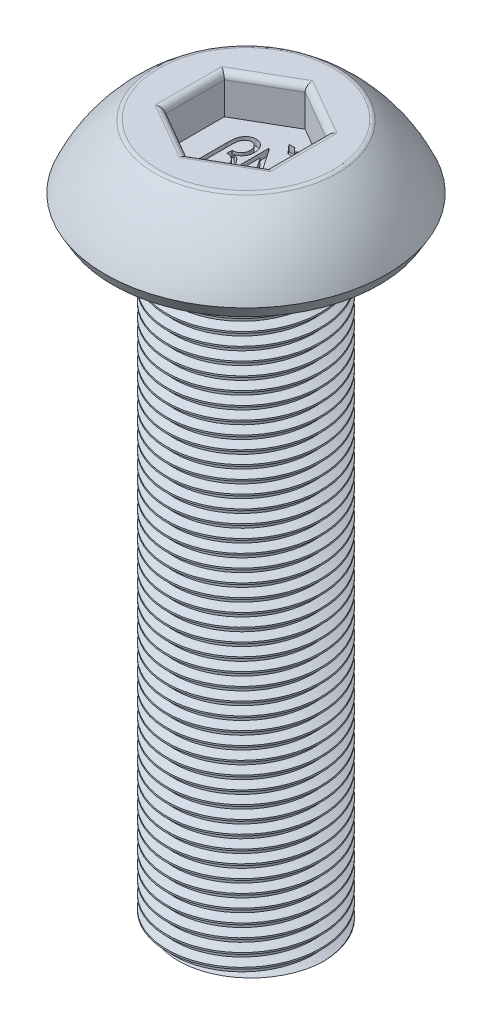
from build123d import *

# Parameters (mm, degrees)
CUT_EXTRUDE1_DEPTH = 0.75
FILLET1_R          = 0.125
WRAP1_START        = -0.125
WRAP1_DEPTH        = 0.125
THREAD1_PITCH      = 0.25


# Read off the part's stored shape, not the designer's step: Wrap1
with BuildPart() as part:
    # Sketch1 → Revolve1 (revolve)
    with BuildSketch(Plane(origin=(0, 0, 0), x_dir=(0, 0, -1), z_dir=(1, 0, 0)), mode=Mode.PRIVATE) as revolve1_sk:
        with BuildLine():
            Line((0, 1.5), (-1.75, 1.5))
            ThreePointArc((-1.75, 1.5), (-2.334912942, 0.942930354), (-2.75, 0.25))
            Line((-2.75, 0.25), (-2.605662433, 0))
            Line((-2.605662433, 0), (-1.5, 0))
            Line((-1.5, 0), (-1.5, -12))
            Line((-1.5, -12), (0, -12))
            Line((0, -12), (0, 1.5))
        make_face()
    revolve(revolve1_sk.sketch.rotate(Axis((0, -12, 0), (0, 1, 0)), 180), axis=Axis((0, -12, 0), (0, 1, 0)))

    # Sketch2 → Cut-Extrude1 (cut)
    with BuildSketch(Plane(origin=(0, 1.5, 0), x_dir=(1, 0, 0), z_dir=(0, 1, 0))):
        Polygon((0, 1.154700538), (-1, 0.577350269), (-1, -0.577350269), (0, -1.154700538), (1, -0.577350269), (1, 0.577350269), align=None)
    extrude(amount=-CUT_EXTRUDE1_DEPTH, mode=Mode.SUBTRACT)

    # Fillet1
    fillet1_edges = [part.edges().sort_by_distance(p)[0] for p in [
        (0.5, 1.5, -0.866025404),
        (-0.5, 1.5, -0.866025404),
        (-1, 1.5, 0),
        (-0.5, 1.5, 0.866025404),
        (0.5, 1.5, 0.866025404),
        (1, 1.5, 0),
        (0, 1.5, 1.75),
    ]]
    fillet(fillet1_edges, radius=FILLET1_R)

    # Wrap1 outline → Wrap1 (cut)
    with BuildSketch(Plane(origin=(0, 0.75, 0), x_dir=(1, 0, 0), z_dir=(0, 1, 0)).offset(WRAP1_START)):
        with BuildLine():
            add(Edge.make_bspline(
                [(-0.537455829, 0.145072229), (-0.537366548, 0.15735919), (-0.537194747, 0.181002472), (-0.536236546, 0.215136123), (-0.534510696, 0.246473554), (-0.531857696, 0.275057496), (-0.528751002, 0.300937263), (-0.524861231, 0.324098842), (-0.520025531, 0.344486675), (-0.512963856, 0.367808475), (-0.501673714, 0.39403328), (-0.484042302, 0.422215735), (-0.462961845, 0.447719467), (-0.43819726, 0.469796385), (-0.410438674, 0.48826361), (-0.379753396, 0.501330341), (-0.346770262, 0.509472114), (-0.323962243, 0.510388658), (-0.312295573, 0.510857485)],
                knots=[0, 0, 0, 0, 0.075666503, 0.145601872, 0.210267314, 0.268902852, 0.322354979, 0.370758742, 0.413447068, 0.451298193, 0.520734923, 0.588514213, 0.655379256, 0.723813985, 0.792131248, 0.85973193, 0.928250616, 1, 1, 1, 1], degree=3))
            Line((-0.537455829, 0.145072229), (-0.537455829, -0.527604053))
            Line((-0.537455829, -0.527604053), (-0.460532752, -0.527604053))
            Line((-0.460532752, -0.527604053), (-0.460532752, 0.137460049))
            add(Edge.make_bspline(
                [(-0.447712239, 0.305328639), (-0.448774545, 0.301469619), (-0.451134212, 0.292897693), (-0.453525545, 0.278533298), (-0.455753975, 0.261566558), (-0.457491806, 0.241915402), (-0.458861613, 0.219538201), (-0.459832928, 0.194491685), (-0.460431178, 0.166843342), (-0.460497896, 0.147543183), (-0.460532752, 0.137460049)],
                knots=[0, 0, 0, 0, 0.071102967, 0.157938928, 0.258486703, 0.375288845, 0.508476997, 0.656953648, 0.820779591, 1, 1, 1, 1], degree=3))
            add(Edge.make_bspline(
                [(-0.310292367, 0.421113895), (-0.317674297, 0.420714803), (-0.332400851, 0.419918636), (-0.353965955, 0.413875353), (-0.374511474, 0.403804365), (-0.393760239, 0.390026559), (-0.411220155, 0.372905819), (-0.426330799, 0.352966004), (-0.438683838, 0.330213781), (-0.444651659, 0.313764569), (-0.447712239, 0.305328639)],
                knots=[0, 0, 0, 0, 0.115143072, 0.229704239, 0.346728965, 0.47082069, 0.597615275, 0.727089869, 0.860038825, 1, 1, 1, 1], degree=3))
            add(Edge.make_bspline(
                [(-0.17848147, 0.261057806), (-0.178952566, 0.271974178), (-0.179864172, 0.293098195), (-0.186637459, 0.323530756), (-0.198777604, 0.350930356), (-0.212261145, 0.371485038), (-0.225066026, 0.38586534), (-0.235235588, 0.395399384), (-0.246252738, 0.403200746), (-0.257654824, 0.410013084), (-0.269995595, 0.414921405), (-0.282862679, 0.418632696), (-0.296413152, 0.420560449), (-0.305613195, 0.420927309), (-0.310292367, 0.421113895)],
                knots=[0, 0, 0, 0, 0.141583044, 0.273974039, 0.401600231, 0.528456794, 0.591043942, 0.651122908, 0.708825408, 0.765880537, 0.822988251, 0.880580103, 0.939262648, 1, 1, 1, 1], degree=3))
            add(Edge.make_bspline(
                [(-0.340941406, 0.087780562), (-0.334988303, 0.08792105), (-0.323299062, 0.088196907), (-0.306225523, 0.090764835), (-0.289888322, 0.094368098), (-0.274654087, 0.100137271), (-0.260174408, 0.107124777), (-0.24682212, 0.11601785), (-0.234254323, 0.126336142), (-0.222711003, 0.138095802), (-0.212416341, 0.151054166), (-0.203323514, 0.164708223), (-0.195692258, 0.179095557), (-0.189162431, 0.194099224), (-0.184457799, 0.209936522), (-0.181072867, 0.226359939), (-0.178698712, 0.243427453), (-0.178554801, 0.255106579), (-0.17848147, 0.261057806)],
                knots=[0, 0, 0, 0, 0.067065692, 0.131687113, 0.194317921, 0.255289037, 0.314878218, 0.375218702, 0.435653028, 0.497934511, 0.56059698, 0.621980302, 0.682601877, 0.743985199, 0.806139168, 0.868443394, 0.932963888, 1, 1, 1, 1], degree=3))
            Line((-0.340941406, 0.087780562), (-0.357968649, 0.087780562))
            Line((-0.357968649, 0.087780562), (-0.357968649, -0.014783541))
            add(Edge.make_bspline(
                [(-0.152840444, -0.246153733), (-0.152991921, -0.237935238), (-0.153288163, -0.221862292), (-0.155672785, -0.198335348), (-0.159894598, -0.176034257), (-0.165736265, -0.154867378), (-0.173053307, -0.13483662), (-0.182215246, -0.116043494), (-0.192787882, -0.098300128), (-0.20519576, -0.081953022), (-0.21910276, -0.067000398), (-0.234429011, -0.053697294), (-0.25160782, -0.04265632), (-0.269991613, -0.033131715), (-0.29004854, -0.025867397), (-0.311286964, -0.019869429), (-0.334167811, -0.016416131), (-0.349879854, -0.015338382), (-0.357968649, -0.014783541)],
                knots=[0, 0, 0, 0, 0.070899124, 0.138657723, 0.203740428, 0.266496883, 0.327925022, 0.387445969, 0.44662859, 0.505853257, 0.564143059, 0.622569358, 0.680413321, 0.739931479, 0.800819634, 0.864131594, 0.930052902, 1, 1, 1, 1], degree=3))
            add(Edge.make_bspline(
                [(-0.309891726, -0.450680977), (-0.304334961, -0.450571211), (-0.293413044, -0.450355466), (-0.277514036, -0.447340483), (-0.262286727, -0.442989313), (-0.247781817, -0.436676481), (-0.233907442, -0.428733085), (-0.221051475, -0.418678171), (-0.208664071, -0.407189838), (-0.197187775, -0.393882067), (-0.186871623, -0.37903336), (-0.17755536, -0.363253667), (-0.169907305, -0.346235338), (-0.163848892, -0.328206631), (-0.158625475, -0.30926113), (-0.155449196, -0.289102842), (-0.15305503, -0.26797937), (-0.152912733, -0.253506267), (-0.152840444, -0.246153733)],
                knots=[0, 0, 0, 0, 0.057830355, 0.113666545, 0.168061557, 0.222616608, 0.278122197, 0.334218011, 0.392319921, 0.453992458, 0.516935927, 0.58055674, 0.644719566, 0.710965936, 0.778658745, 0.849251577, 0.923417744, 1, 1, 1, 1], degree=3))
            add(Edge.make_bspline(
                [(-0.409250701, -0.417427771), (-0.40035509, -0.422552084), (-0.383473121, -0.432276934), (-0.357561529, -0.44229785), (-0.333383308, -0.449497533), (-0.317482442, -0.450298576), (-0.309891726, -0.450680977)],
                knots=[0, 0, 0, 0, 0.290177362, 0.550694617, 0.785511707, 1, 1, 1, 1], degree=3))
            Line((-0.409250701, -0.417427771), (-0.409250701, -0.507371682))
            add(Edge.make_bspline(
                [(-0.298273137, -0.540424566), (-0.308861639, -0.540097242), (-0.329301798, -0.539465371), (-0.358664913, -0.532954409), (-0.385682425, -0.522833546), (-0.401463988, -0.512480121), (-0.409250701, -0.507371682)],
                knots=[0, 0, 0, 0, 0.269471748, 0.52019112, 0.763259579, 1, 1, 1, 1], degree=3))
            add(Edge.make_bspline(
                [(-0.075917367, -0.249759502), (-0.076128163, -0.26018073), (-0.076541077, -0.280594276), (-0.079227651, -0.310491914), (-0.084396107, -0.33890103), (-0.091033777, -0.365960134), (-0.09992887, -0.391457717), (-0.110563094, -0.41559927), (-0.123397597, -0.438155636), (-0.137962217, -0.459132621), (-0.153934421, -0.478163377), (-0.171095941, -0.494958486), (-0.189740067, -0.508821331), (-0.209271063, -0.520337979), (-0.2298646, -0.529505832), (-0.251686582, -0.535889962), (-0.274626983, -0.539804561), (-0.290311376, -0.540215808), (-0.298273137, -0.540424566)],
                knots=[0, 0, 0, 0, 0.076485505, 0.149823073, 0.219996399, 0.288217649, 0.354082023, 0.417919027, 0.481558234, 0.544225908, 0.605087621, 0.663657146, 0.720011753, 0.77514507, 0.829777395, 0.884976008, 0.941611157, 1, 1, 1, 1], degree=3))
            add(Edge.make_bspline(
                [(-0.194707432, 0.00885428), (-0.185532098, 0.002246917), (-0.167142487, -0.010995852), (-0.14356067, -0.035865532), (-0.123015599, -0.064046821), (-0.106173919, -0.095826321), (-0.092429948, -0.130510752), (-0.082995533, -0.168026939), (-0.077008082, -0.208034101), (-0.076287996, -0.23558107), (-0.075917367, -0.249759502)],
                knots=[0, 0, 0, 0, 0.114174048, 0.228832702, 0.344903554, 0.466103946, 0.591676048, 0.72144281, 0.856626542, 1, 1, 1, 1], degree=3))
            add(Edge.make_bspline(
                [(-0.273032752, 0.036899152), (-0.264977593, 0.035253476), (-0.249714467, 0.032135208), (-0.228666305, 0.025295577), (-0.210172583, 0.018341569), (-0.199638474, 0.011879289), (-0.194707432, 0.00885428)],
                knots=[0, 0, 0, 0, 0.294434237, 0.557901696, 0.79305271, 1, 1, 1, 1], degree=3))
            add(Edge.make_bspline(
                [(-0.200917367, 0.061939216), (-0.205600715, 0.059219735), (-0.215469689, 0.053489114), (-0.232413767, 0.046806913), (-0.251771921, 0.040993346), (-0.265723651, 0.038306664), (-0.273032752, 0.036899152)],
                knots=[0, 0, 0, 0, 0.211315364, 0.445293882, 0.709397831, 1, 1, 1, 1], degree=3))
            add(Edge.make_bspline(
                [(-0.101558393, 0.265064216), (-0.101829728, 0.254158186), (-0.102360461, 0.23282596), (-0.107582885, 0.201794643), (-0.115635878, 0.172523389), (-0.127393107, 0.145424978), (-0.141807851, 0.120566799), (-0.158666737, 0.09801557), (-0.178511599, 0.078390972), (-0.193428545, 0.067437991), (-0.200917367, 0.061939216)],
                knots=[0, 0, 0, 0, 0.138734507, 0.271365083, 0.399463796, 0.524371928, 0.64626696, 0.764603187, 0.881822663, 1, 1, 1, 1], degree=3))
            add(Edge.make_bspline(
                [(-0.312295573, 0.510857485), (-0.304601721, 0.510709635), (-0.289468193, 0.510418818), (-0.267407867, 0.506806308), (-0.246411552, 0.501505665), (-0.226632783, 0.49383833), (-0.208041676, 0.483900131), (-0.190537128, 0.47184286), (-0.174217748, 0.457507541), (-0.159329374, 0.44106616), (-0.145724285, 0.423136003), (-0.133914037, 0.403846519), (-0.123827558, 0.383480477), (-0.115525112, 0.361982783), (-0.109489008, 0.339238969), (-0.104721569, 0.315513437), (-0.102229905, 0.290624502), (-0.101784813, 0.273682609), (-0.101558393, 0.265064216)],
                knots=[0, 0, 0, 0, 0.063537388, 0.124975739, 0.184284437, 0.242302503, 0.299838056, 0.35817297, 0.417627897, 0.478966986, 0.541230446, 0.60342781, 0.66563497, 0.728883988, 0.793562004, 0.859921094, 0.928741429, 1, 1, 1, 1], degree=3))
        make_face()
        Polygon((0.565629107, -0.527604053), (0.583056992, -0.527604053), (0.583056992, 0.472395947), (0.506133915, 0.472395947), (0.506133915, -0.290224246), (-0.016101662, 0.472395947), (-0.032327624, 0.472395947), (-0.032327624, -0.527604053), (0.044595453, -0.527604053), (0.044595453, 0.233012934), align=None)
        Polygon((0.095877504, 0.741626716), (0.244315004, 0.574960049), (0.318633915, 0.574960049), (0.467672376, 0.741626716), (0.350885517, 0.741626716), (0.280172376, 0.662700434), (0.212664363, 0.741626716), align=None)
    extrude(amount=WRAP1_DEPTH, mode=Mode.SUBTRACT)

    # Thread1: the profile of Thread Profile1 profile screwed along a right-hand helix of 51 turns, 6 arcs to a turn; built about Z, then put on its axis
    thread1_z = Axis((0, 0, 0), (0, 0, 1))
    thread1_corners = [(1.5003, 0, -0.000173205), (1.5003, 0, 0.218923204), (1.364683531, 0, 0.140625), (1.364683531, 0, 0.078125)]
    with BuildLine(mode=Mode.PRIVATE) as thread1_profile:
        Line(thread1_corners[0], thread1_corners[1])
        Line(thread1_corners[1], thread1_corners[2])
        Line(thread1_corners[2], thread1_corners[3])
        Line(thread1_corners[3], thread1_corners[0])
    thread1_cap = Face(thread1_profile.wire())
    thread1_turn_angles = [0, 30, 60, 90, 120, 150, 180, 210, 240, 270, 300, 330, 360, 390, 420, 450, 480, 510, 540, 570, 600, 630, 660, 690, 720]
    thread1_turn_weights = [1, 0.8660254037844387, 1, 0.8660254037844387, 1, 0.8660254037844387, 1, 0.8660254037844387, 1, 0.8660254037844387, 1, 0.8660254037844387, 1, 0.8660254037844387, 1, 0.8660254037844387, 1, 0.8660254037844387, 1, 0.8660254037844387, 1, 0.8660254037844387, 1, 0.8660254037844387, 1]
    thread1_turn_rails = [Edge.make_bspline([Vector(p[0], p[1], 0).rotate(thread1_z, thread1_turn_angles[k]) / thread1_turn_weights[k] + Vector(0, 0, p[2] + THREAD1_PITCH * thread1_turn_angles[k] / 360) for k in range(25)], [0, 0, 0, 1, 1, 2, 2, 3, 3, 4, 4, 5, 5, 6, 6, 7, 7, 8, 8, 9, 9, 10, 10, 11, 11, 12, 12, 12], 2, thread1_turn_weights) for p in thread1_corners]
    thread1_turn_sides = [Face.make_surface_from_curves(thread1_turn_rails[p[0]], thread1_turn_rails[p[1]]) for p in [(0, 1), (1, 2), (2, 3), (3, 0)]]
    thread1_last_angles = [18000, 18030, 18060, 18090, 18120, 18150, 18180, 18210, 18240, 18270, 18300, 18330, 18360]
    thread1_last_weights = [1, 0.8660254037844387, 1, 0.8660254037844387, 1, 0.8660254037844387, 1, 0.8660254037844387, 1, 0.8660254037844387, 1, 0.8660254037844387, 1]
    thread1_last_rails = [Edge.make_bspline([Vector(p[0], p[1], 0).rotate(thread1_z, thread1_last_angles[k]) / thread1_last_weights[k] + Vector(0, 0, p[2] + THREAD1_PITCH * thread1_last_angles[k] / 360) for k in range(13)], [0, 0, 0, 1, 1, 2, 2, 3, 3, 4, 4, 5, 5, 6, 6, 6], 2, thread1_last_weights) for p in thread1_corners]
    thread1_last_sides = [Face.make_surface_from_curves(thread1_last_rails[p[0]], thread1_last_rails[p[1]]) for p in [(0, 1), (1, 2), (2, 3), (3, 0)]]
    thread1 = Plane(origin=(0, -13, 0), x_dir=(1, 0, 0), z_dir=(0, 1, 0)) * Solid(Shell([*[p.moved(Location((0, 0, 2 * THREAD1_PITCH * i))) for i in range(25) for p in thread1_turn_sides], *thread1_last_sides, thread1_cap, thread1_cap.rotate(thread1_z, 18360).moved(Location((0, 0, THREAD1_PITCH * 18360 / 360)))]))
    add(thread1, mode=Mode.SUBTRACT)


solid = part.part
